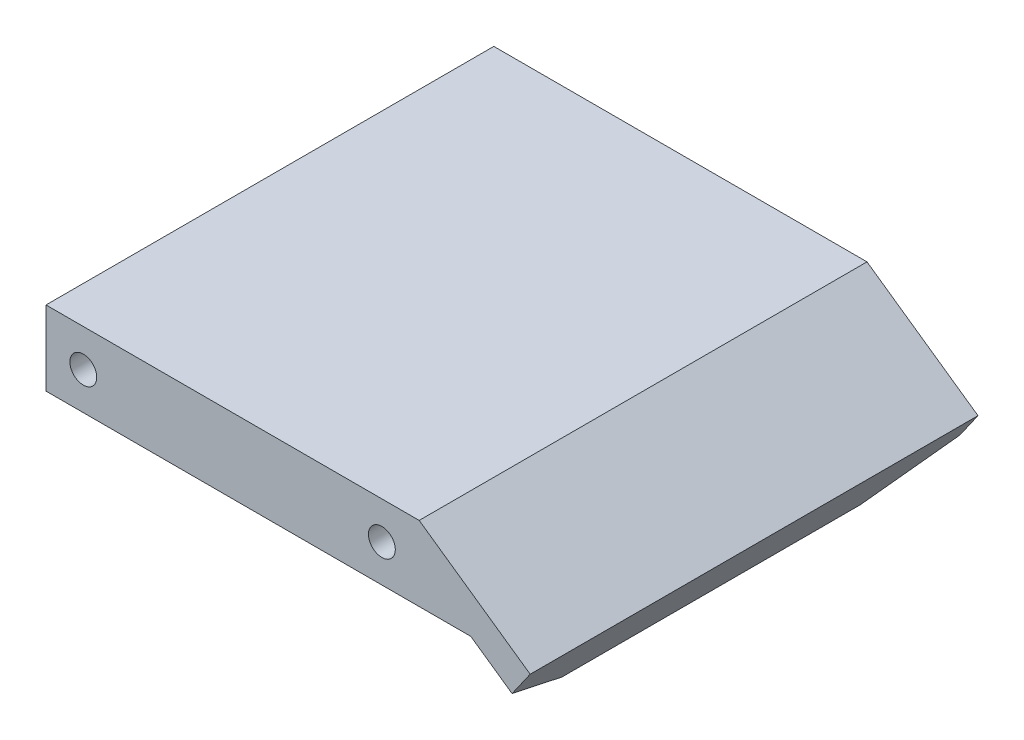
from build123d import *

# Parameters (mm, degrees)
BOSS_EXTRUDE1_DEPTH = 76.2
SKETCH2_R           = 2.286
CUT_EXTRUDE1_DEPTH  = 12.7
CUT_EXTRUDE2_REACH  = 108.967
SKETCH5_R           = 2.286
CUT_EXTRUDE4_DEPTH  = 115.681914017


with BuildPart() as part:
    # Sketch1 → Boss-Extrude1 (new body)
    with BuildSketch(Plane.XY):
        Polygon((0, 0), (63.5, 0), (82.384972567, -13.22340015), (75.100551825, -23.626631112), (59.495705381, -12.7), (0, -12.7), align=None)
    extrude(amount=BOSS_EXTRUDE1_DEPTH)

    # Sketch2 → Cut-Extrude1 (cut)
    with BuildSketch(Plane(origin=(0, 0, 0), x_dir=(-1, 0, 0), z_dir=(0, 0, -1))):
        with Locations((-6.35, -6.35)):
            Circle(SKETCH2_R)
    extrude(amount=-CUT_EXTRUDE1_DEPTH, mode=Mode.SUBTRACT)

    # Cut-Extrude2: up to this plane
    cut_extrude2_end = Plane(origin=(59.495705381, -12.7, 76.2), z_dir=(0, 1, 0))
    # Sketch3 → Cut-Extrude2 (cut, up to the surface)
    with BuildSketch(Plane(origin=(61.494112117, -43.05864086, 0), x_dir=(0, 0, -1), z_dir=(0.8191520442889909, -0.5735764363510475, 0)), mode=Mode.PRIVATE) as cut_extrude2_sk1:
        Polygon((-76.2, 31.054452127), (-63.5, 23.722103708), (-76.2, 23.722103708), align=None)
    cut_extrude2_tool1 = split(extrude(cut_extrude2_sk1.sketch, amount=-CUT_EXTRUDE2_REACH, mode=Mode.PRIVATE), bisect_by=cut_extrude2_end, keep=Keep.BOTH, mode=Mode.PRIVATE)
    add(cut_extrude2_tool1.solids().sort_by_distance((76.502439, -21.624528, 71.966667))[0], mode=Mode.SUBTRACT)
    # Sketch3 → Cut-Extrude2 (cut, up to the surface)
    with BuildSketch(Plane(origin=(61.494112117, -43.05864086, 0), x_dir=(0, 0, -1), z_dir=(0.8191520442889909, -0.5735764363510475, 0)), mode=Mode.PRIVATE) as cut_extrude2_sk2:
        Polygon((-12.7, 23.722103708), (0, 23.722103708), (0, 31.054452127), align=None)
    cut_extrude2_tool2 = split(extrude(cut_extrude2_sk2.sketch, amount=-CUT_EXTRUDE2_REACH, mode=Mode.PRIVATE), bisect_by=cut_extrude2_end, keep=Keep.BOTH, mode=Mode.PRIVATE)
    add(cut_extrude2_tool2.solids().sort_by_distance((76.502439, -21.624528, 4.233333))[0], mode=Mode.SUBTRACT)

    # Sketch5 → Cut-Extrude4 (cut, through all)
    with BuildSketch(Plane.XY.offset(76.2)):
        with Locations((6.35, -6.35)):
            Circle(SKETCH5_R)
        with Locations((57.15, -6.35)):
            Circle(SKETCH5_R)
    extrude(amount=-CUT_EXTRUDE4_DEPTH, mode=Mode.SUBTRACT)


solid = part.part
